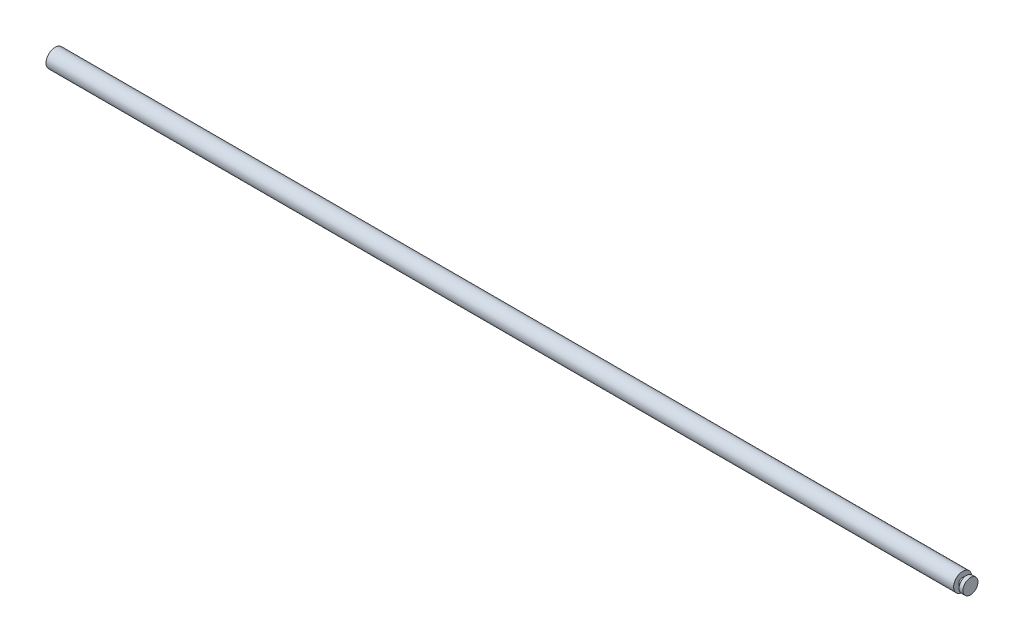
from build123d import *


with BuildPart() as part:
    # Sketch1 → Revolve2 (revolve)
    with BuildSketch(Plane.XY):
        Polygon((-176.5, 0), (176.5, 0), (176.5, 2.9), (175, 2.9), (175, 1.5), (173.5, 1.5), (173.5, 3.5), (-176.5, 3.5), align=None)
    revolve(axis=Axis((-176.5, 0, 0), (1, 0, 0)))


solid = part.part
